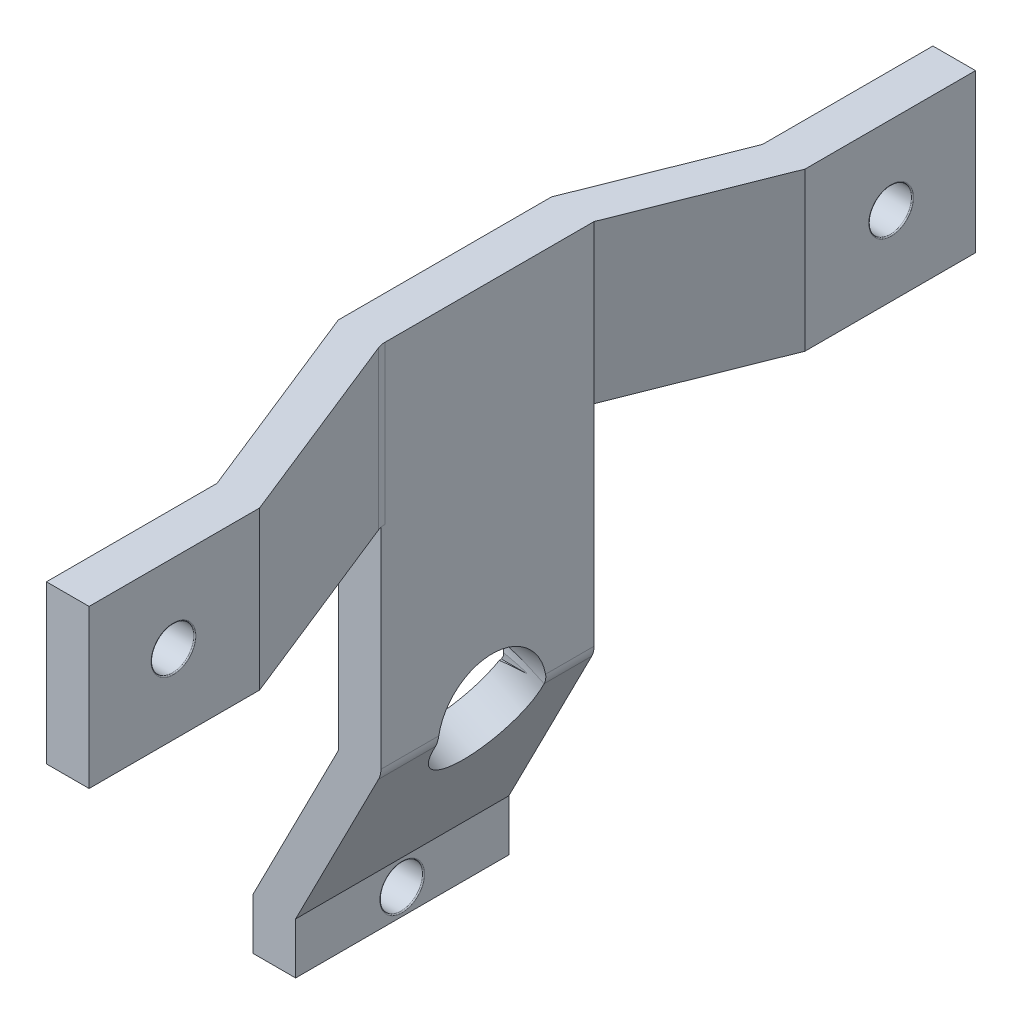
from build123d import *

# Parameters (mm, degrees)
BOSS_EXTRUDE1_DEPTH = 50
BOSS_EXTRUDE2_DEPTH = 37
FILLET1_R           = 5.08
FILLET2_R           = 5.08
SKETCH3_R           = 5
CUT_EXTRUDE3_DEPTH  = 50.8
SKETCH4_R           = 5
CUT_EXTRUDE4_DEPTH  = 171.088377471
FILLET4_R           = 0.254
FILLET5_R           = 0.254
FILLET6_R           = 0.254
FILLET7_R           = 0.254
FILLET8_R           = 0.254
FILLET9_R           = 0.254
CUT_EXTRUDE10_DEPTH = 50.8
CUT_EXTRUDE11_DEPTH = 50.8


with BuildPart() as part:
    # Sketch1 → Boss-Extrude1 (new body)
    with BuildSketch(Plane.XY):
        Polygon((-10, 50.490294942), (0, 50.490294942), (0, 0), (-20, -39.173504696), (-20, -51.173504696), (-30, -51.173504696), (-30, -39.173504696), (-10, 0), align=None)
    extrude(amount=BOSS_EXTRUDE1_DEPTH)

    # Sketch2 → Boss-Extrude2 (add)
    with BuildSketch(Plane(origin=(0, 50.490294942, 0), x_dir=(1, 0, 0), z_dir=(0, 1, 0))):
        Polygon((-10, -50), (8.955903958, -97.400232567), (8.955903958, -137.400232567), (18.955903958, -137.400232567), (18.955903958, -97.400232567), (0, -50), (0, 0), (14.082883878, 35.4021936), (14.082883878, 75.4021936), (4.082883878, 75.4021936), (4.082883878, 35.4021936), (-10, 0), align=None)
    extrude(amount=BOSS_EXTRUDE2_DEPTH)

    # Fillet1
    fillet1_edges = [part.edges().sort_by_distance(p)[0] for p in [
        (0, 0, 25),
    ]]
    fillet(fillet1_edges, radius=FILLET1_R)

    # Fillet2
    # the kernel refuses this fillet: 5.08 mm, written as the material it adds along each edge
    with BuildSketch(Plane(origin=(0, 50.490294942, 50), x_dir=(0, 0, -1), z_dir=(0, 1, 0))) as fillet2_piece_1:
        with BuildLine():
            CenterArc((FILLET2_R * 0.192542896513, -FILLET2_R), FILLET2_R, 90, 21.797044179)
            Line((-FILLET2_R * 0.17877703906, -FILLET2_R * 0.0714950159281), (0, 0))
            Line((0, 0), (FILLET2_R * 0.192542896513, 0))
        make_face()
    extrude(amount=37)

    # Sketch3 → Cut-Extrude3 (cut)
    with BuildSketch(Plane.ZY.offset(10)):
        with Locations(Location((-55.607256236, 68.990294942, 0), (0, 0, 180))):
            Circle(SKETCH3_R)
        with Locations((117.605295203, 68.990294942)):
            Circle(SKETCH3_R)
    extrude(amount=-CUT_EXTRUDE3_DEPTH, mode=Mode.SUBTRACT)

    # Sketch4 → Cut-Extrude4 (cut, through all)
    with BuildSketch(Plane.ZY.offset(30)):
        with Locations((25, -45.170029219)):
            Circle(SKETCH4_R)
    extrude(amount=-CUT_EXTRUDE4_DEPTH, mode=Mode.SUBTRACT)

    # Fillet4
    fillet4_edges = [part.edges().sort_by_distance(p)[0] for p in [
        (-20, -45.170029219, 20),
    ]]
    fillet(fillet4_edges, radius=FILLET4_R)

    # Fillet5
    fillet5_edges = [part.edges().sort_by_distance(p)[0] for p in [
        (-30, -45.170029219, 20),
    ]]
    fillet(fillet5_edges, radius=FILLET5_R)

    # Fillet6
    fillet6_edges = [part.edges().sort_by_distance(p)[0] for p in [
        (14.082883878, 68.990294942, -50.607256236),
    ]]
    fillet(fillet6_edges, radius=FILLET6_R)

    # Fillet7
    fillet7_edges = [part.edges().sort_by_distance(p)[0] for p in [
        (4.082883878, 68.990294942, -50.607256236),
    ]]
    fillet(fillet7_edges, radius=FILLET7_R)

    # Fillet8
    fillet8_edges = [part.edges().sort_by_distance(p)[0] for p in [
        (18.955903958, 68.990294942, 112.605295203),
    ]]
    fillet(fillet8_edges, radius=FILLET8_R)

    # Fillet9
    fillet9_edges = [part.edges().sort_by_distance(p)[0] for p in [
        (8.955903958, 68.990294942, 112.605295203),
    ]]
    fillet(fillet9_edges, radius=FILLET9_R)

    # Sketch18 → Cut-Extrude10 (cut)
    with BuildSketch(Plane(origin=(0, 0, 0), x_dir=(-0.4547141869090671, -0.8906374168109186, 0), z_dir=(0.8906374168109186, -0.4547141869090671, 0))):
        with BuildLine():
            Line((1.22178269, -11.158701567), (1.22178269, -36.634326405))
            ThreePointArc((1.22178269, -36.634326405), (14.872545986, -23.896513986), (1.22178269, -11.158701567))
        make_face()
    extrude(amount=-CUT_EXTRUDE10_DEPTH, mode=Mode.SUBTRACT)

    # Sketch20 → Cut-Extrude11 (cut)
    with BuildSketch(Plane(origin=(0, 0, 0), x_dir=(0, 0, -1), z_dir=(1, 0, 0))):
        with BuildLine():
            Line((-11.158701567, -1.088165379), (-36.634326405, -1.088165379))
            ThreePointArc((-36.634326405, -1.088165379), (-23.896513986, 11.64964704), (-11.158701567, -1.088165379))
        make_face()
    extrude(amount=-CUT_EXTRUDE11_DEPTH, mode=Mode.SUBTRACT)


solid = part.part
